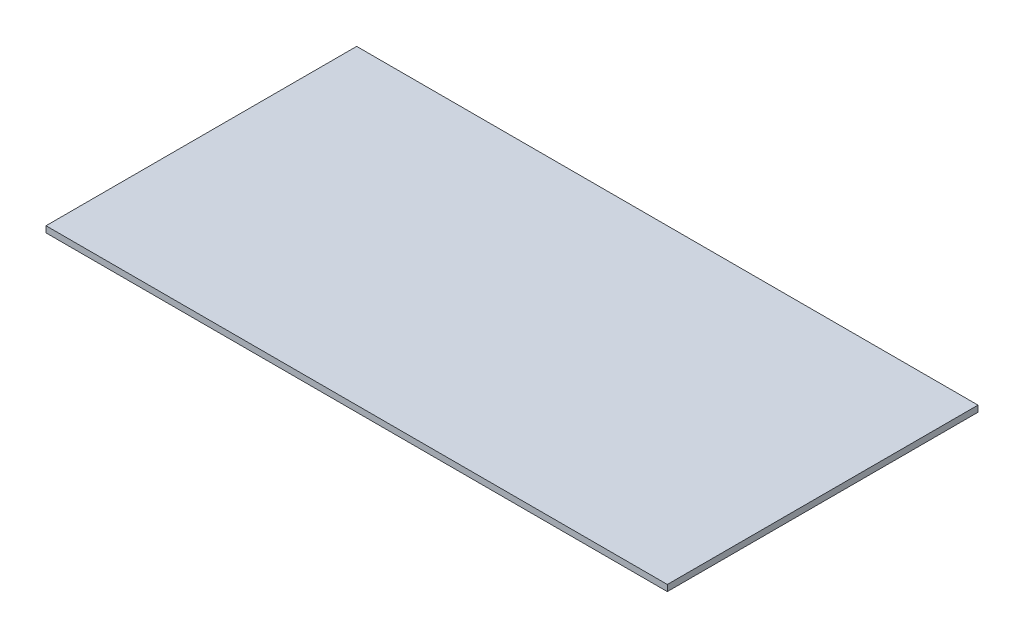
from build123d import *

# Parameters (mm, degrees)
SKETCH1_W           = 304.8
SKETCH1_H           = 152.4
BOSS_EXTRUDE1_DEPTH = 3.048


with BuildPart() as part:
    # Sketch1 → Boss-Extrude1 (new body)
    with BuildSketch(Plane(origin=(0, 0, 0), x_dir=(1, 0, 0), z_dir=(0, 1, 0))):
        Rectangle(SKETCH1_W, SKETCH1_H)
    extrude(amount=BOSS_EXTRUDE1_DEPTH)


solid = part.part
